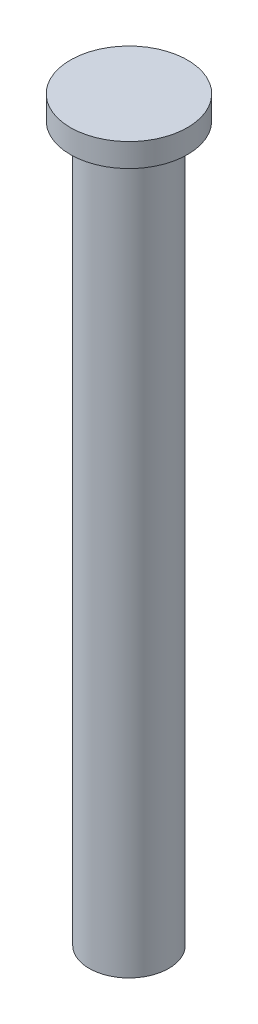
from build123d import *

# Parameters (mm, degrees)
ESQUISSE1_R        = 3.4
BOSS_EXTRU_1_DEPTH = 61
ESQUISSE3_R        = 5
BOSS_EXTRU_2_DEPTH = 2


with BuildPart() as part:
    # Esquisse1 → Boss.-Extru.1 (new body)
    with BuildSketch(Plane(origin=(0, 0, 0), x_dir=(1, 0, 0), z_dir=(0, 1, 0))):
        Circle(ESQUISSE1_R)
    extrude(amount=BOSS_EXTRU_1_DEPTH)

    # Esquisse3 → Boss.-Extru.2 (add)
    with BuildSketch(Plane(origin=(0, 61, 0), x_dir=(1, 0, 0), z_dir=(0, 1, 0))):
        Circle(ESQUISSE3_R)
    extrude(amount=BOSS_EXTRU_2_DEPTH)


solid = part.part
